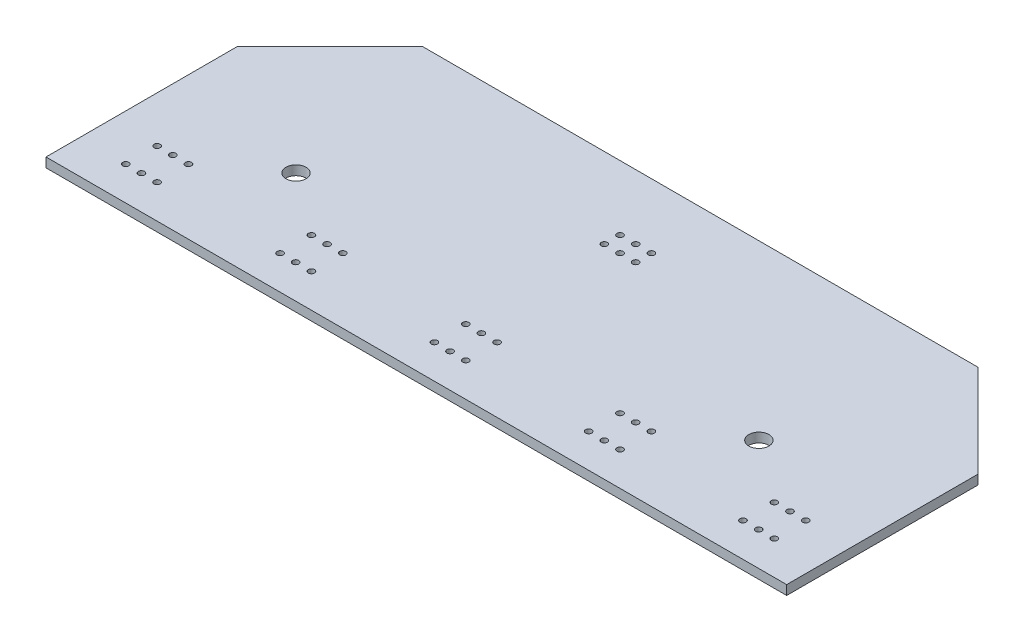
from build123d import *

# Parameters (mm, degrees)
SKETCH1_W             = 120
SKETCH1_H             = 50
BOSS_EXTRUDE1_DEPTH   = 1.53
SKETCH2_R             = 0.5
PUSHBUTTONHOLES_DEPTH = 67.229456437
SKETCH7_R             = 1.625
MOUNT_HOLES_DEPTH     = 67.229456437
SKETCH5_R             = 0.5
RJ12HOLES_DEPTH       = 67.229456437
SKETCH6_W             = 141.050966046
SKETCH6_H             = 69.53153639
SKETCH6_W_2           = 120
SKETCH6_H_2           = 50
CUT_EXTRUDE4_DEPTH    = 67.229456437
LPATTERN1_COUNT       = 3
LPATTERN1_PITCH       = 25
LPATTERN1_COL_COUNT   = 3
LPATTERN1_COL_PITCH   = 25


with BuildPart() as part:
    # Sketch1 → Boss-Extrude1 (new body)
    with BuildSketch(Plane(origin=(0, 0, 0), x_dir=(1, 0, 0), z_dir=(0, 1, 0))):
        with Locations((0, 3)):
            Rectangle(SKETCH1_W, SKETCH1_H)
    extrude(amount=BOSS_EXTRUDE1_DEPTH)

    # Sketch2 → PushButtonHoles (cut, through all)
    with BuildSketch(Plane(origin=(0, 1.53, 0), x_dir=(1, 0, 0), z_dir=(0, 1, 0))):
        with Locations((-2.54, -7.46)):
            Circle(SKETCH2_R)
        with Locations((0, -7.46)):
            Circle(SKETCH2_R)
        with Locations((2.54, -7.46)):
            Circle(SKETCH2_R)
        with Locations((-2.54, -12.54)):
            Circle(SKETCH2_R)
        with Locations((0, -12.54)):
            Circle(SKETCH2_R)
        with Locations((2.54, -12.54)):
            Circle(SKETCH2_R)
    pushbuttonholes = extrude(amount=-PUSHBUTTONHOLES_DEPTH, mode=Mode.SUBTRACT)

    # Sketch7 → Mount Holes (cut, through all)
    with BuildSketch(Plane(origin=(0, 1.53, 0), x_dir=(1, 0, 0), z_dir=(0, 1, 0))):
        with Locations((-37.5, 0)):
            Circle(SKETCH7_R)
        with Locations((37.5, 0)):
            Circle(SKETCH7_R)
    extrude(amount=-MOUNT_HOLES_DEPTH, mode=Mode.SUBTRACT)

    # Sketch5 → RJ12Holes (cut, through all)
    with BuildSketch(Plane(origin=(0, 1.53, 0), x_dir=(1, 0, 0), z_dir=(0, 1, 0))):
        with Locations((-2.54, 17.54)):
            Circle(SKETCH5_R)
        with Locations((0, 17.54)):
            Circle(SKETCH5_R)
        with Locations((2.54, 17.54)):
            Circle(SKETCH5_R)
        with Locations((-2.54, 15)):
            Circle(SKETCH5_R)
        with Locations((0, 15)):
            Circle(SKETCH5_R)
        with Locations((2.54, 15)):
            Circle(SKETCH5_R)
    extrude(amount=-RJ12HOLES_DEPTH, mode=Mode.SUBTRACT)

    # Sketch6 → Cut-Extrude4 (cut, through all)
    # profile 1 of 4: a face of its own
    with BuildSketch(Plane(origin=(0, 1.53, 0), x_dir=(1, 0, 0), z_dir=(0, 1, 0))):
        Rectangle(SKETCH6_W, SKETCH6_H)
        with Locations((0, 3)):
            Rectangle(SKETCH6_W_2, SKETCH6_H_2, mode=Mode.SUBTRACT)
    # profile 2 of 4: a face of its own
    with BuildSketch(Plane(origin=(0, 1.53, 0), x_dir=(1, 0, 0), z_dir=(0, 1, 0))):
        Polygon((60, -18), (-60, -18), (-60, -22), (-52, -22), (-28, -22), (60, -22), align=None)
    # profile 3 of 4: a face of its own
    with BuildSketch(Plane(origin=(0, 1.53, 0), x_dir=(1, 0, 0), z_dir=(0, 1, 0))):
        Polygon((-60, 13), (-45, 28), (-60, 28), align=None)
    # profile 4 of 4: a face of its own
    with BuildSketch(Plane(origin=(0, 1.53, 0), x_dir=(1, 0, 0), z_dir=(0, 1, 0))):
        Polygon((60, 28), (45, 28), (60, 13), align=None)
    extrude(amount=-CUT_EXTRUDE4_DEPTH, mode=Mode.SUBTRACT)

    # LPattern1: PushButtonHoles ×3
    with Locations(*[(i * LPATTERN1_PITCH, 0, 0) for i in range(1, LPATTERN1_COUNT)]):
        add(pushbuttonholes, mode=Mode.SUBTRACT)

    # LPattern1 col: PushButtonHoles ×3
    with Locations(*[(-i * LPATTERN1_COL_PITCH, 0, 0) for i in range(1, LPATTERN1_COL_COUNT)]):
        add(pushbuttonholes, mode=Mode.SUBTRACT)


solid = part.part
